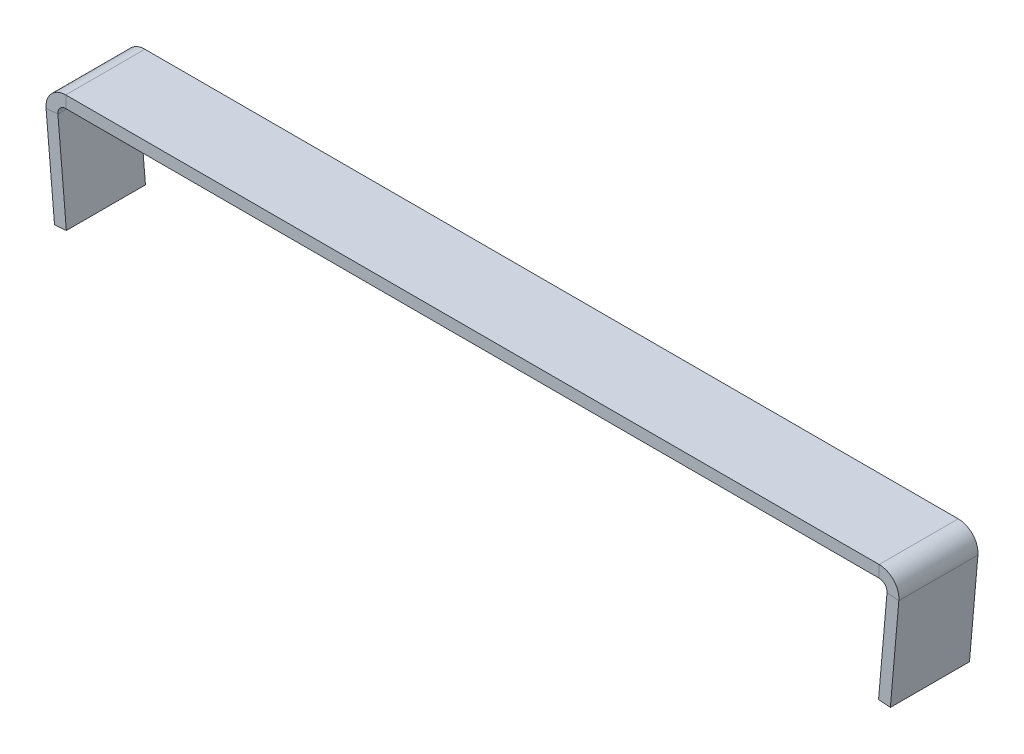
from build123d import *

# Parameters (mm, degrees)
SKETCH1_W                      = 210
SKETCH1_H                      = 20
BASE_FLANGE1_DEPTH             = 3
EDGE_FLANGE1_STRIP_CUT_DEPTH   = 20
EDGE_FLANGE1_STRIP_CUT_2_DEPTH = 20
EDGE_FLANGE1_DEPTH             = 20
EDGE_FLANGE1_BEND_DEPTH        = 20


# Sheet-metal steps are written as plain solids
with BuildPart() as part:
    # Sketch1 → Base-Flange1 (new body)
    with BuildSketch(Plane(origin=(0, 0, 0), x_dir=(1, 0, 0), z_dir=(0, 1, 0))):
        Rectangle(SKETCH1_W, SKETCH1_H)
    extrude(amount=-BASE_FLANGE1_DEPTH)

    # Edge-Flange1 strip (across the edge) → Edge-Flange1 strip cut (cut)
    with BuildSketch(Plane(origin=(-105, -3, 10), x_dir=(0.9961946980917459, 0.08715574274765482, 0), z_dir=(0, 0, -1))):
        Polygon((-14.95871317, -4.320177336), (2.435778714, -2.798356488), (2.174311485, 0.190227606), (-15.220180398, -1.331593242), align=None)
    extrude(amount=EDGE_FLANGE1_STRIP_CUT_DEPTH, mode=Mode.SUBTRACT)

    # Edge-Flange1 strip 2 (across the edge) → Edge-Flange1 strip cut 2 (cut)
    with BuildSketch(Plane(origin=(105, -3, -10), x_dir=(-0.9961946980917459, 0.08715574274765482, 0), z_dir=(0, 0, 1))):
        Polygon((-14.95871317, -4.320177336), (2.435778714, -2.798356488), (2.174311485, 0.190227606), (-15.220180398, -1.331593242), align=None)
    extrude(amount=EDGE_FLANGE1_STRIP_CUT_2_DEPTH, mode=Mode.SUBTRACT)

    # Edge-Flange1 section (across the edge) → Edge-Flange1 (add)
    with BuildSketch(Plane(origin=(-105, -3, 10), x_dir=(0.9961946980917459, 0.08715574274765482, 0), z_dir=(0, 0, -1))):
        with BuildLine():
            Line((-3, 2.182617002), (-3, 26.726074497))
            Line((-3, 26.726074497), (0, 26.726074497))
            Line((0, 26.726074497), (0, 2.182617002))
            ThreePointArc((0, 2.182617002), (0.648819585, 0.708062329), (2.174311485, 0.190227606))
            Line((2.174311485, 0.190227606), (2.435778714, -2.798356488))
            ThreePointArc((2.435778714, -2.798356488), (-1.377951038, -1.503769682), (-3, 2.182617002))
        make_face()
    extrude(amount=EDGE_FLANGE1_DEPTH)

    # Edge-Flange1 section 2 (across the edge) → Edge-Flange1 bend (add)
    with BuildSketch(Plane(origin=(105, -3, -10), x_dir=(-0.9961946980917459, 0.08715574274765482, 0), z_dir=(0, 0, 1))):
        with BuildLine():
            Line((-3, 2.182617002), (-3, 26.726074497))
            Line((-3, 26.726074497), (0, 26.726074497))
            Line((0, 26.726074497), (0, 2.182617002))
            ThreePointArc((0, 2.182617002), (0.648819585, 0.708062329), (2.174311485, 0.190227606))
            Line((2.174311485, 0.190227606), (2.435778714, -2.798356488))
            ThreePointArc((2.435778714, -2.798356488), (-1.377951038, -1.503769682), (-3, 2.182617002))
        make_face()
    extrude(amount=EDGE_FLANGE1_BEND_DEPTH)


solid = part.part
